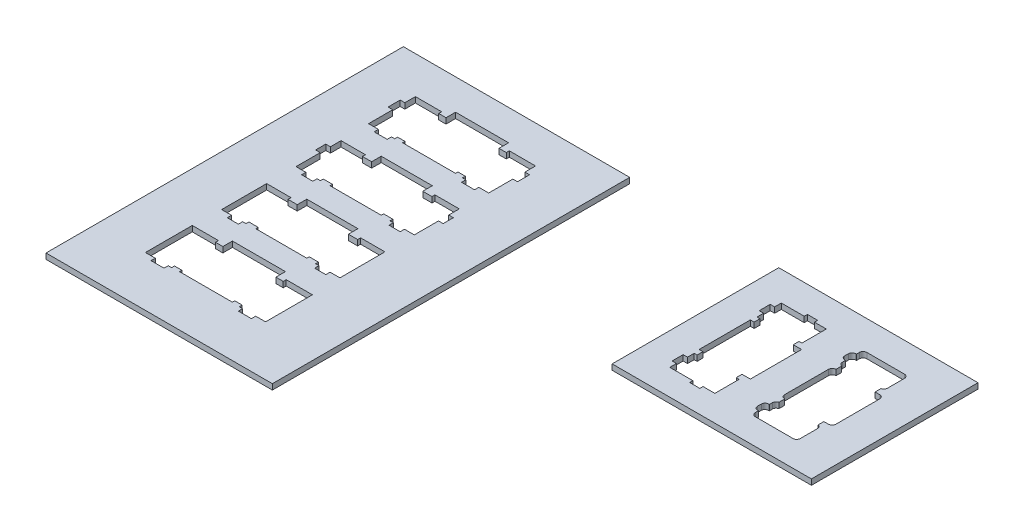
from build123d import *

# Parameters (mm, degrees)
SKETCH1_W             = 61.836497932
SKETCH1_H             = 97.626516797
BOSS_EXTRUDE1_DEPTH   = 1.524
SKETCH1_W_2           = 54.429201556
SKETCH1_H_2           = 45.514073715
BOSS_EXTRUDE1_2_DEPTH = 1.524
FILLET1_R             = 1


with BuildPart() as part:
    # Sketch1 → Boss-Extrude1 (new body)
    with BuildSketch(Plane(origin=(0, 0, 0), x_dir=(1, 0, 0), z_dir=(0, 1, 0))):
        with Locations((1.045725848, -12.885335867)):
            Rectangle(SKETCH1_W, SKETCH1_H)
        Polygon((6.985, -6.985), (-6.985, -6.985), (-6.985, -6.3246), (-9.4996, -6.3246), (-9.4996, -7.112), (-10.414, -7.112), (-10.414, -8.2804), (-13.462, -8.2804), (-13.462, -7.112), (-16.1544, -7.112), (-16.1544, -0.508), (-17.4244, -0.508), (-17.4244, 2.286), (-16.1544, 2.286), (-16.1544, 5.1816), (-9.4996, 5.1816), (-9.4996, 4.3688), (-6.985, 4.3688), (-6.985, 6.985), (6.985, 6.985), (6.985, 4.3688), (9.4996, 4.3688), (9.4996, 5.1816), (16.1544, 5.1816), (16.1544, 2.286), (17.4244, 2.286), (17.4244, -0.508), (16.1544, -0.508), (16.1544, -7.112), (13.462, -7.112), (13.462, -8.2804), (10.414, -8.2804), (10.414, -7.112), (9.4996, -7.112), (9.4996, -6.3246), (6.985, -6.3246), align=None, mode=Mode.SUBTRACT)
        Polygon((6.985, -27.305), (-6.985, -27.305), (-6.985, -26.6446), (-9.4996, -26.6446), (-9.4996, -27.432), (-10.414, -27.432), (-10.414, -28.6004), (-13.462, -28.6004), (-13.462, -27.432), (-16.1544, -27.432), (-16.1544, -15.1384), (-9.4996, -15.1384), (-9.4996, -15.9512), (-6.985, -15.9512), (-6.985, -13.335), (6.985, -13.335), (6.985, -15.9512), (9.4996, -15.9512), (9.4996, -15.1384), (16.1544, -15.1384), (16.1544, -27.432), (13.462, -27.432), (13.462, -28.6004), (10.414, -28.6004), (10.414, -27.432), (9.4996, -27.432), (9.4996, -26.6446), (6.985, -26.6446), align=None, mode=Mode.SUBTRACT)
        Polygon((7.239, 13.081), (-7.239, 13.081), (-7.239, 13.7414), (-9.2456, 13.7414), (-9.2456, 12.954), (-10.16, 12.954), (-10.16, 11.7856), (-13.716, 11.7856), (-13.716, 12.954), (-16.4084, 12.954), (-16.4084, 19.558), (-17.6784, 19.558), (-17.6784, 22.86), (-16.4084, 22.86), (-16.4084, 25.7556), (-9.2456, 25.7556), (-9.2456, 24.9428), (-7.239, 24.9428), (-7.239, 27.559), (7.239, 27.559), (7.239, 24.9428), (9.2456, 24.9428), (9.2456, 25.7556), (16.4084, 25.7556), (16.4084, 22.86), (17.6784, 22.86), (17.6784, 19.558), (16.4084, 19.558), (16.4084, 12.954), (13.716, 12.954), (13.716, 11.7856), (10.16, 11.7856), (10.16, 12.954), (9.2456, 12.954), (9.2456, 13.7414), (7.239, 13.7414), align=None, mode=Mode.SUBTRACT)
        Polygon((7.239, -47.879), (-7.239, -47.879), (-7.239, -47.2186), (-9.2456, -47.2186), (-9.2456, -48.006), (-10.16, -48.006), (-10.16, -49.1744), (-13.716, -49.1744), (-13.716, -48.006), (-16.4084, -48.006), (-16.4084, -35.2044), (-9.2456, -35.2044), (-9.2456, -36.0172), (-7.239, -36.0172), (-7.239, -33.401), (7.239, -33.401), (7.239, -36.0172), (9.2456, -36.0172), (9.2456, -35.2044), (16.4084, -35.2044), (16.4084, -48.006), (13.716, -48.006), (13.716, -49.1744), (10.16, -49.1744), (10.16, -48.006), (9.2456, -48.006), (9.2456, -47.2186), (7.239, -47.2186), align=None, mode=Mode.SUBTRACT)
    extrude(amount=BOSS_EXTRUDE1_DEPTH)


with BuildPart() as body_2:
    # Sketch1 → Boss-Extrude1 2 (new body)
    with BuildSketch(Plane(origin=(0, 0, 0), x_dir=(1, 0, 0), z_dir=(0, 1, 0))):
        with Locations((100.91149804, 12.154107113)):
            Rectangle(SKETCH1_W_2, SKETCH1_H_2)
        Polygon((82.16797354, 18.674191876), (82.16797354, 4.674191876), (83.19798494, 4.674191876), (83.19798494, 3.099191876), (82.39798494, 3.099191876), (82.39798494, 1.274191876), (81.19798494, 1.274191876), (81.19798494, -1.725808124), (82.39798494, -1.725808124), (82.39798494, -3.550808124), (88.66798494, -3.550808124), (88.66798494, -4.425808124), (91.46798494, -4.425808124), (91.46798494, -3.550808124), (94.69798494, -3.550808124), (94.69798494, 3.099191876), (93.89798494, 3.099191876), (93.89798494, 4.674191876), (96.16798494, 4.674191876), (96.16798494, 18.674191876), (93.89798494, 18.674191876), (93.89798494, 20.249191876), (94.69798494, 20.249191876), (94.69798494, 26.899191876), (91.46798494, 26.899191876), (91.46798494, 27.774191876), (88.66798494, 27.774191876), (88.66798494, 26.899191876), (82.39798494, 26.899191876), (82.39798494, 25.074191876), (81.19798494, 25.074191876), (81.19798494, 22.074191876), (82.39798494, 22.074191876), (82.39798494, 20.249191876), (83.19798494, 20.249191876), (83.19798494, 18.674191876), align=None, mode=Mode.SUBTRACT)
        Polygon((104.52830059, 18.674191876), (104.52830059, 4.674191876), (105.55831199, 4.674191876), (105.55831199, 3.099191876), (104.75831199, 3.099191876), (104.75831199, 1.274191876), (103.55831199, 1.274191876), (103.55831199, -1.725808124), (104.75831199, -1.725808124), (104.75831199, -3.550808124), (111.02831199, -3.550808124), (113.82831199, -3.550808124), (117.05831199, -3.550808124), (117.05831199, 3.099191876), (116.25831199, 3.099191876), (116.25831199, 4.674191876), (118.52831199, 4.674191876), (118.52831199, 18.674191876), (116.25831199, 18.674191876), (116.25831199, 20.249191876), (117.05831199, 20.249191876), (117.05831199, 26.899191876), (113.82831199, 26.899191876), (111.02831199, 26.899191876), (104.75831199, 26.899191876), (104.75831199, 25.074191876), (103.55831199, 25.074191876), (103.55831199, 22.074191876), (104.75831199, 22.074191876), (104.75831199, 20.249191876), (105.55831199, 20.249191876), (105.55831199, 18.674191876), align=None, mode=Mode.SUBTRACT)
    extrude(amount=BOSS_EXTRUDE1_2_DEPTH)

    # Fillet1
    # the kernel refuses this fillet: 1 mm, written as the material it adds along each edge
    with BuildSketch(Plane(origin=(104.75831199, 0, -20.249191876), x_dir=(1.0, 0, -1.5099033134897623e-12), z_dir=(0, 1, 0)), Plane(origin=(117.05831199, 0, -3.099191876), x_dir=(-1.0, 0, 1.5643042416963231e-12), z_dir=(0, 1, 0))) as fillet1_piece_1:
        with BuildLine():
            CenterArc((1, 0.979795897), FILLET1_R, 180, 78.463040967)
            Line((0, 0.979795897), (-0.02, 0.979795897))
            Line((-0.02, 0.979795897), (-0.02, 0))
            Line((-0.02, 0), (0, -0.02))
            ThreePointArc((0, -0.02), (0.4, -0.02), (0.796, -0.019595918))
            Line((0.796, -0.019595918), (0.8, 0))
        make_face()
    extrude(amount=1.524)
    with BuildSketch(Plane(origin=(103.55831199, 0, -22.074191876), x_dir=(1, 0, 0), z_dir=(0, 1, 0)), Plane(origin=(103.55831199, 0, -25.074191876), x_dir=(0, 0, 1), z_dir=(0, 1, 0)), Plane(origin=(104.75831199, 0, -26.899191876), x_dir=(0, 0, 1), z_dir=(0, 1, 0)), Plane(origin=(117.05831199, 0, -26.899191876), x_dir=(-1, 0, 0), z_dir=(0, 1, 0)), Plane(origin=(118.52831199, 0, -18.674191876), x_dir=(-1, 0, 0), z_dir=(0, 1, 0)), Plane(origin=(118.52831199, 0, -4.674191876), x_dir=(0, 0, -1), z_dir=(0, 1, 0)), Plane(origin=(117.05831199, 0, 3.550808124), x_dir=(0, 0, -1), z_dir=(0, 1, 0)), Plane(origin=(104.75831199, 0, 3.550808124), x_dir=(1, 0, 0), z_dir=(0, 1, 0)), Plane(origin=(103.55831199, 0, -1.274191876), x_dir=(0, 0, 1), z_dir=(0, 1, 0)), Plane(origin=(103.55831199, 0, 1.725808124), x_dir=(1, 0, 0), z_dir=(0, 1, 0)), Plane(origin=(104.52830059, 0, -4.674191876), x_dir=(1, 0, 0), z_dir=(0, 1, 0))) as fillet1_piece_2:
        with BuildLine():
            CenterArc((FILLET1_R, FILLET1_R), FILLET1_R, 180, 90)
            Line((0, FILLET1_R), (-FILLET1_R * 0.02, FILLET1_R))
            Line((-FILLET1_R * 0.02, FILLET1_R), (-FILLET1_R * 0.02, -FILLET1_R * 0.02))
            Line((-FILLET1_R * 0.02, -FILLET1_R * 0.02), (FILLET1_R, -FILLET1_R * 0.02))
            Line((FILLET1_R, -FILLET1_R * 0.02), (FILLET1_R, 0))
        make_face()
    extrude(amount=1.524)
    with BuildSketch(Plane(origin=(117.05831199, 0, -20.249191876), x_dir=(0, 0, -1), z_dir=(0, 1, 0)), Plane(origin=(104.75831199, 0, -3.099191876), x_dir=(0, 0, 1), z_dir=(0, 1, 0))) as fillet1_piece_3:
        with BuildLine():
            CenterArc((0.979795897, 1), FILLET1_R, 191.536959033, 78.463040967)
            Line((0, 0.8), (-0.019595918, 0.796))
            ThreePointArc((-0.019595918, 0.796), (-0.02, 0.4), (-0.02, 0))
            Line((-0.02, 0), (0, -0.02))
            Line((0, -0.02), (0.979795897, -0.02))
            Line((0.979795897, -0.02), (0.979795897, 0))
        make_face()
    extrude(amount=1.524)
    with BuildSketch(Plane(origin=(104.52830059, 0, -18.674191876), x_dir=(1, 0, 0), z_dir=(0, 1, 0))) as fillet1_piece_4:
        with BuildLine():
            CenterArc((FILLET1_R, -FILLET1_R), FILLET1_R, 90, 90)
            Line((0, -FILLET1_R), (-FILLET1_R * 0.02, -FILLET1_R))
            Line((-FILLET1_R * 0.02, -FILLET1_R), (-FILLET1_R * 0.02, FILLET1_R * 0.02))
            Line((-FILLET1_R * 0.02, FILLET1_R * 0.02), (FILLET1_R, FILLET1_R * 0.02))
            Line((FILLET1_R, FILLET1_R * 0.02), (FILLET1_R, 0))
        make_face()
    extrude(amount=1.524)


solid = Compound([part.part, body_2.part])
